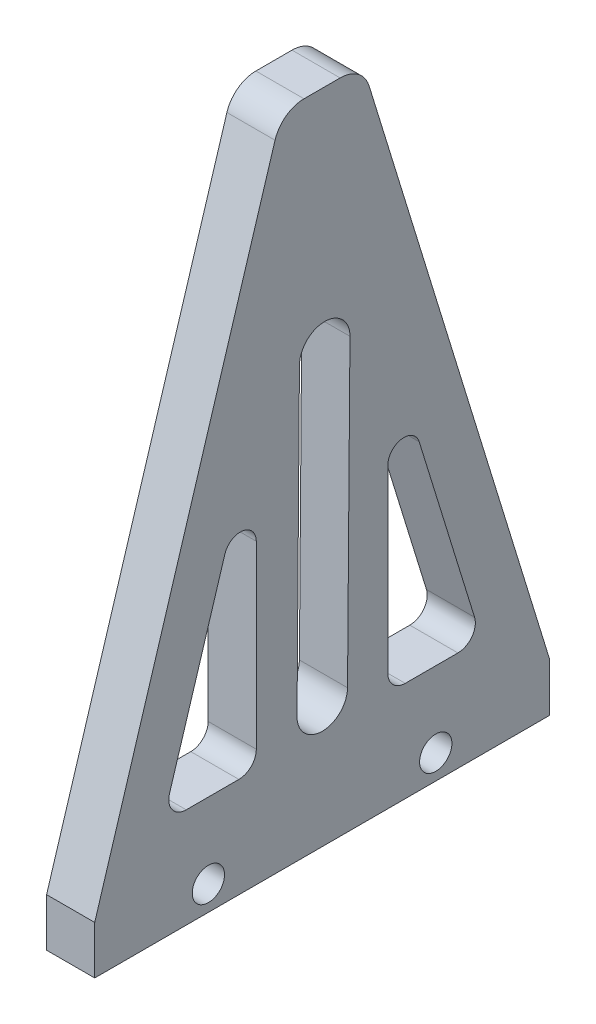
from build123d import *

# Parameters (mm, degrees)
BOSS_EXTRUDE1_DEPTH       = 2.3815
M3_CLEARANCE_HOLE1_D      = 3.2
F_1_0MM_START             = -2.3815
F_1_0MM_DOWEL_SLOT1_DEPTH = 4.763


# Read off the part's stored shape, not the designer's step: Ø1.0mm Dowel Slot1
with BuildPart() as part:
    # Sketch1 → Boss-Extrude1 (new, symmetric)
    with BuildSketch(Plane(origin=(0, 0, 0), x_dir=(0, 0, -1), z_dir=(1, 0, 0))):
        with BuildLine():
            Line((-22.5, 0), (22.5, 0))
            Line((22.5, 0), (22.5, 4.873))
            Line((22.5, 4.873), (4.655163533, 62.882072013))
            ThreePointArc((4.655163533, 62.882072013), (3.570153218, 64.413111688), (1.787769426, 65))
            Line((1.787769426, 65), (-1.787769426, 65))
            ThreePointArc((-1.787769426, 65), (-3.570795025, 64.412637502), (-4.655632377, 62.880546477))
            Line((-4.655632377, 62.880546477), (-22.5, 4.763))
            Line((-22.5, 4.763), (-22.5, 0))
        make_face()
        with BuildLine():
            Line((6.507919955, 11.613028191), (6.507919955, 29.434537867))
            ThreePointArc((6.507919955, 29.434537867), (7.858931987, 31.004324378), (9.612461298, 29.90223629))
            Line((9.612461298, 29.90223629), (15.094257994, 12.121307765))
            ThreePointArc((15.094257994, 12.121307765), (14.833637596, 10.588440441), (13.445586349, 9.887784348))
            Line((13.445586349, 9.887784348), (8.233163799, 9.887784348))
            ThreePointArc((8.233163799, 9.887784348), (7.013232178, 10.39309657), (6.507919955, 11.613028191))
        make_face(mode=Mode.SUBTRACT)
        with BuildLine():
            Line((-9.612461298, 29.90223629), (-15.094257994, 12.121307765))
            ThreePointArc((-15.094257994, 12.121307765), (-14.833637596, 10.588440441), (-13.445586349, 9.887784348))
            Line((-13.445586349, 9.887784348), (-8.233163799, 9.887784348))
            ThreePointArc((-8.233163799, 9.887784348), (-7.013232178, 10.39309657), (-6.507919955, 11.613028191))
            Line((-6.507919955, 11.613028191), (-6.507919955, 29.434537867))
            ThreePointArc((-6.507919955, 29.434537867), (-7.858931987, 31.004324378), (-9.612461298, 29.90223629))
        make_face(mode=Mode.SUBTRACT)
    extrude(amount=BOSS_EXTRUDE1_DEPTH, both=True)

    # M3 Clearance Hole1 (through all)
    with Locations(Plane(origin=(2.3815, 0, 0), x_dir=(0, 0, -1), z_dir=(1, 0, 0))):
        with Locations((11.25, 2.4365), (-11.250134442, 2.436499343)):
            Hole(M3_CLEARANCE_HOLE1_D / 2)

    # Ø1.0mm Dowel Slot1 outline → Ø1.0mm Dowel Slot1 (cut)
    with BuildSketch(Plane.YZ.offset(F_1_0MM_START)):
        with BuildLine():
            Line((12.367584087, -2.520038343), (42.366612584, -2.761469965))
            ThreePointArc((42.366612584, -2.761469965), (44.886650928, -0.281670226), (42.406851188, 2.238368118))
            Line((42.406851188, 2.238368118), (12.407822691, 2.47979974))
            ThreePointArc((12.407822691, 2.47979974), (9.887784348, 0), (12.367584087, -2.520038343))
        make_face()
    extrude(amount=F_1_0MM_DOWEL_SLOT1_DEPTH, mode=Mode.SUBTRACT)


solid = part.part
